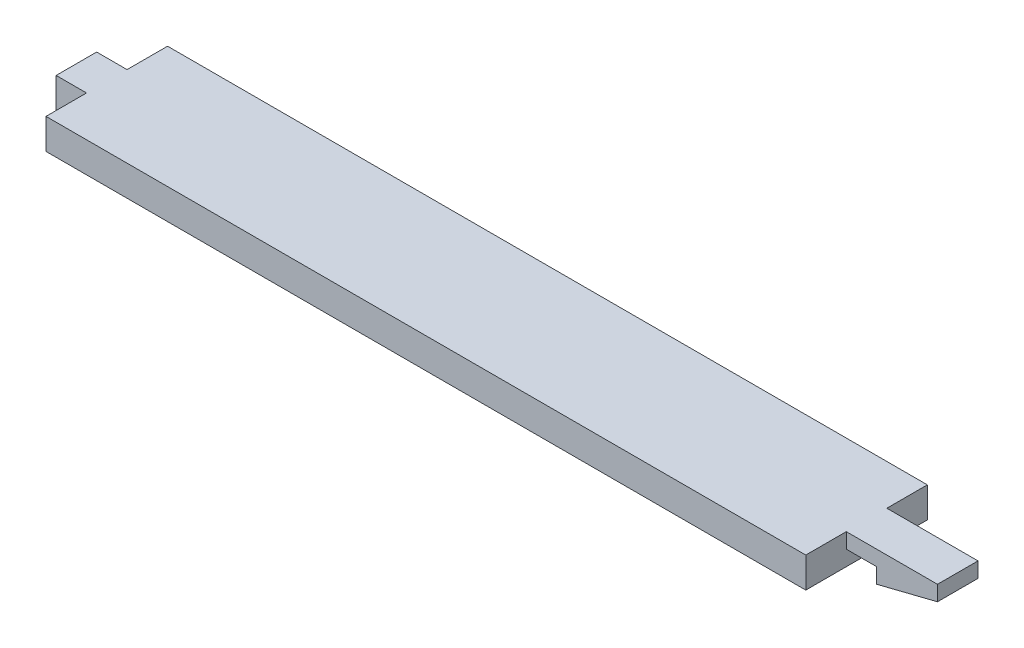
from build123d import *

# Parameters (mm, degrees)
SKETCH1_W           = 184.15
SKETCH1_H           = 25.4
BOSS_EXTRUDE1_DEPTH = 6.35
SKETCH4_W           = 6.35
SKETCH4_H           = 8.466666667
CUT_EXTRUDE1_DEPTH  = 187.001895152
SKETCH5_W           = 19.05
SKETCH5_H           = 8.466666667
CUT_EXTRUDE2_DEPTH  = 6.35
SKETCH6_W           = 6.35
SKETCH6_H           = 8.466666666
CUT_EXTRUDE3_DEPTH  = 3.175
CHAMFER3_SIZE2      = 3.175
CHAMFER3_SIZE       = 12.7


with BuildPart() as part:
    # Sketch1 → Boss-Extrude1 (new body)
    with BuildSketch(Plane(origin=(0, 0, 0), x_dir=(1, 0, 0), z_dir=(0, 1, 0))):
        with Locations((92.075, -12.7)):
            Rectangle(SKETCH1_W, SKETCH1_H)
    extrude(amount=BOSS_EXTRUDE1_DEPTH)

    # Sketch4 → Cut-Extrude1 (cut, through all)
    with BuildSketch(Plane(origin=(0, 6.35, 0), x_dir=(1, 0, 0), z_dir=(0, 1, 0))):
        with Locations((3.175, -4.233333334)):
            Rectangle(SKETCH4_W, SKETCH4_H)
        with Locations((3.175, -21.166666666)):
            Rectangle(SKETCH4_W, SKETCH4_H)
    extrude(amount=-CUT_EXTRUDE1_DEPTH, mode=Mode.SUBTRACT)

    # Sketch5 → Cut-Extrude2 (cut)
    with BuildSketch(Plane(origin=(0, 6.35, 0), x_dir=(1, 0, 0), z_dir=(0, 1, 0))):
        with Locations((174.625, -21.166666666)):
            Rectangle(SKETCH5_W, SKETCH5_H)
        with Locations((174.625, -4.233333334)):
            Rectangle(SKETCH5_W, SKETCH5_H)
    extrude(amount=-CUT_EXTRUDE2_DEPTH, mode=Mode.SUBTRACT)

    # Sketch6 → Cut-Extrude3 (cut)
    with BuildSketch(Plane.XZ):
        with Locations((168.275, 12.7)):
            Rectangle(SKETCH6_W, SKETCH6_H)
    extrude(amount=-CUT_EXTRUDE3_DEPTH, mode=Mode.SUBTRACT)

    # Chamfer3
    chamfer3_edges = [part.edges().sort_by_distance(p)[0] for p in [
        (184.15, 0, 12.7),
    ]]
    chamfer3_side = [part.faces().sort_by_distance(p)[0] for p in [
        (184.0865, 0, 12.7),
    ]]
    chamfer(chamfer3_edges, length=CHAMFER3_SIZE - 0.0001, length2=CHAMFER3_SIZE2 - 0.0001, reference=chamfer3_side[0])  # a hair under: the kernel refuses the full size


solid = part.part
